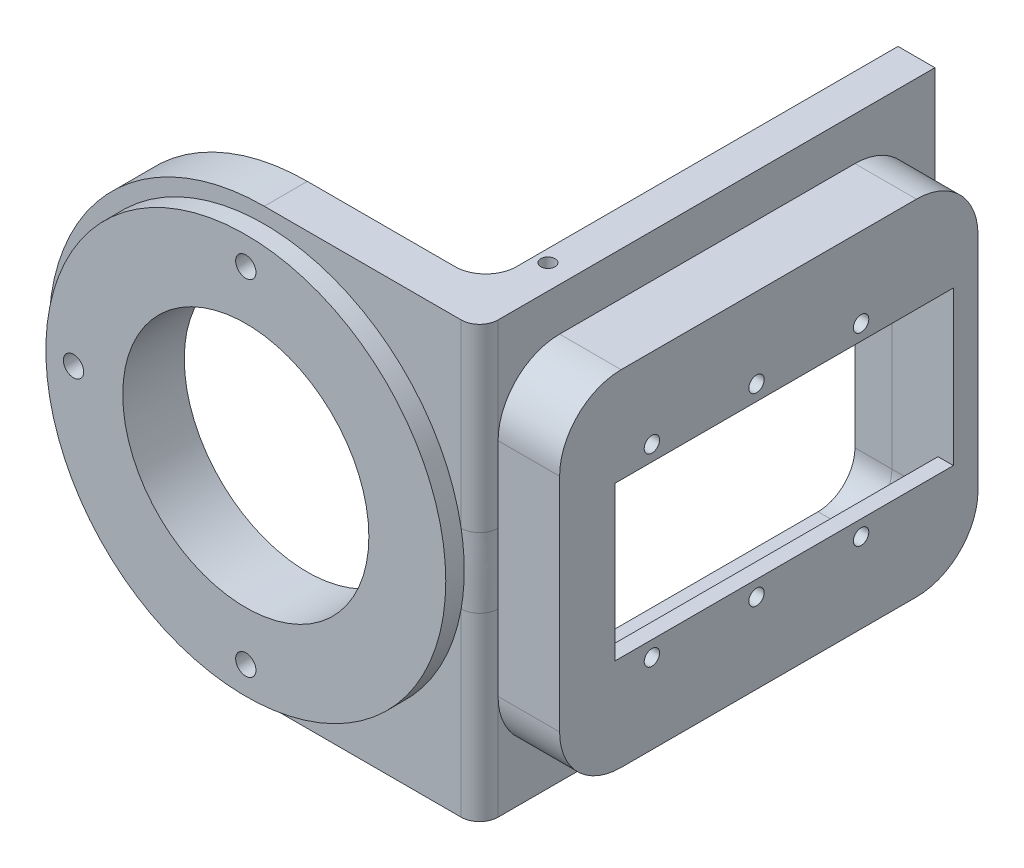
from build123d import *

# Parameters (mm, degrees)
SKETCH1_R           = 32.5
BOSS_EXTRUDE1_DEPTH = 3
SKETCH10_W          = 70
SKETCH10_H          = 70
BOSS_EXTRUDE6_DEPTH = 74
BOSS_EXTRUDE2_DEPTH = 10
SKETCH11_W          = 64
SKETCH11_H          = 67
CUT_EXTRUDE5_DEPTH  = 114.375482358
CUT_EXTRUDE2_DEPTH  = 110.79070999
SKETCH5_R           = 1.25
BOSS_EXTRUDE3_DEPTH = 2.5
CUT_EXTRUDE6_DEPTH  = 6
FILLET1_R           = 3
SKETCH17_R          = 1.65
CUT_EXTRUDE9_DEPTH  = 88.971586438
SKETCH19_W          = 2
SKETCH19_H          = 4.2
CUT_EXTRUDE10_DEPTH = 4
SKETCH21_W          = 2
SKETCH21_H          = 4.2
CUT_EXTRUDE11_DEPTH = 4
SKETCH22_R          = 1.15
CUT_EXTRUDE12_DEPTH = 4
SKETCH24_R          = 20
CUT_EXTRUDE14_DEPTH = 10
FILLET4_START       = -35
FILLET4_DEPTH       = 17.0000001
FILLET4_START_2     = 17.9999999
FILLET4_2_DEPTH     = 17.0000001
FILLET4_START_3     = 23.9999999
FILLET4_3_DEPTH     = 5.0000001
FILLET6_R           = 35
SKETCH25_W          = 4.2
SKETCH25_H          = 2
CUT_EXTRUDE15_DEPTH = 4
SKETCH26_R          = 1.15
CUT_EXTRUDE16_DEPTH = 10


with BuildPart() as part:
    # Sketch1 → Boss-Extrude1 (new body)
    with BuildSketch(Plane.XY):
        Circle(SKETCH1_R)
    extrude(amount=-BOSS_EXTRUDE1_DEPTH)

    # Sketch10 → Boss-Extrude6 (add)
    with BuildSketch(Plane(origin=(0, 0, -3), x_dir=(-1, 0, 0), z_dir=(0, 0, -1))):
        Rectangle(SKETCH10_W, SKETCH10_H)
    extrude(amount=BOSS_EXTRUDE6_DEPTH)

    # Sketch11 → Cut-Extrude5 (cut, through all)
    with BuildSketch(Plane(origin=(0, 35, 0), x_dir=(1, 0, 0), z_dir=(0, 1, 0))):
        with Locations((-3, 43.5)):
            Rectangle(SKETCH11_W, SKETCH11_H)
    extrude(amount=-CUT_EXTRUDE5_DEPTH, mode=Mode.SUBTRACT)

    # Sketch13 → Cut-Extrude6 (cut)
    with BuildSketch(Plane(origin=(35, 0, 0), x_dir=(0, 0, -1), z_dir=(1, 0, 0))):
        with BuildLine():
            Line((10, 18), (10, -18))
            ThreePointArc((10, -18), (11.757359313, -22.242640687), (16, -24))
            Line((16, -24), (64, -24))
            ThreePointArc((64, -24), (68.242640687, -22.242640687), (70, -18))
            Line((70, -18), (70, 18))
            ThreePointArc((70, 18), (68.242640687, 22.242640687), (64, 24))
            Line((64, 24), (16, 24))
            ThreePointArc((16, 24), (11.757359313, 22.242640687), (10, 18))
        make_face()
    extrude(amount=-CUT_EXTRUDE6_DEPTH, mode=Mode.SUBTRACT)

    # Fillet1
    fillet1_edges = [part.edges().sort_by_distance(p)[0] for p in [
        (35, 0, -3),
    ]]
    fillet(fillet1_edges, radius=FILLET1_R)

    # Sketch17 → Cut-Extrude9 (cut, through all)
    with BuildSketch(Plane(origin=(0, 0, -10), x_dir=(-1, 0, 0), z_dir=(0, 0, -1))):
        with Locations((0, 28)):
            Circle(SKETCH17_R)
        with Locations((28, 0)):
            Circle(SKETCH17_R)
        with Locations((0, -28)):
            Circle(SKETCH17_R)
    extrude(amount=-CUT_EXTRUDE9_DEPTH, mode=Mode.SUBTRACT)

    # Sketch19 → Cut-Extrude10 (cut)
    with BuildSketch(Plane.ZY.offset(-29)):
        with Locations((-72, 25.9)):
            Rectangle(SKETCH19_W, SKETCH19_H)
        with Locations((-72, -25.9)):
            Rectangle(SKETCH19_W, SKETCH19_H)
    extrude(amount=-CUT_EXTRUDE10_DEPTH, mode=Mode.SUBTRACT)

    # Sketch21 → Cut-Extrude11 (cut)
    with BuildSketch(Plane(origin=(0, 0, -10), x_dir=(-1, 0, 0), z_dir=(0, 0, -1))):
        with Locations((30, 25.9)):
            Rectangle(SKETCH21_W, SKETCH21_H)
        with Locations((30, -25.9)):
            Rectangle(SKETCH21_W, SKETCH21_H)
    extrude(amount=-CUT_EXTRUDE11_DEPTH, mode=Mode.SUBTRACT)

    # Sketch22 → Cut-Extrude12 (cut)
    with BuildSketch(Plane(origin=(0, 0, -77), x_dir=(-1, 0, 0), z_dir=(0, 0, -1))):
        with Locations((-31, 25.9)):
            Circle(SKETCH22_R)
        with Locations((-31, -25.9)):
            Circle(SKETCH22_R)
    extrude(amount=-CUT_EXTRUDE12_DEPTH, mode=Mode.SUBTRACT)

    # Sketch24 → Cut-Extrude14 (cut)
    with BuildSketch(Plane(origin=(0, 0, -10), x_dir=(-1, 0, 0), z_dir=(0, 0, -1))):
        Circle(SKETCH24_R)
    extrude(amount=-CUT_EXTRUDE14_DEPTH, mode=Mode.SUBTRACT)

    # Fillet4: read off the stored shape, not the designer's step
    # Fillet4 outline → Fillet4 (add)
    with BuildSketch(Plane(origin=(0, 0, 0), x_dir=(1, 0, 0), z_dir=(0, 1, 0)).offset(FILLET4_START)):
        with BuildLine():
            Line((29, 10), (29, 15))
            ThreePointArc((29, 15), (27.535533906, 11.464466094), (24, 10))
            Line((24, 10), (29, 10))
        make_face()
    extrude(amount=FILLET4_DEPTH)

    # Fillet4 2 outline → Fillet4 2 (add)
    with BuildSketch(Plane(origin=(0, 0, 0), x_dir=(1, 0, 0), z_dir=(0, 1, 0)).offset(FILLET4_START_2)):
        with BuildLine():
            Line((29, 10), (29, 15))
            ThreePointArc((29, 15), (27.535533906, 11.464466094), (24, 10))
            Line((24, 10), (29, 10))
        make_face()
    extrude(amount=FILLET4_2_DEPTH)

    # Fillet4 3 outline → Fillet4 3 (cut)
    with BuildSketch(Plane.YZ.offset(FILLET4_START_3)):
        with BuildLine():
            Line((17.9999999, -16), (24, -16))
            ThreePointArc((24, -16), (22.242640687, -11.757359313), (18, -10))
            Line((18, -10), (17.9999999, -16))
        make_face()
        with BuildLine():
            Line((-24, -16), (-17.9999999, -16))
            Line((-17.9999999, -16), (-18, -10))
            ThreePointArc((-18, -10), (-22.242640687, -11.757359313), (-24, -16))
        make_face()
    extrude(amount=FILLET4_3_DEPTH, mode=Mode.SUBTRACT)

    # Fillet6
    fillet6_edges = [part.edges().sort_by_distance(p)[0] for p in [
        (-35, -35, -6.5),
        (-35, 35, -6.5),
    ]]
    fillet(fillet6_edges, radius=FILLET6_R - 0.0001)  # a hair under: the kernel refuses the full size

    # Sketch25 → Cut-Extrude15 (cut)
    with BuildSketch(Plane(origin=(29, 0, 19), x_dir=(0, 0, 1), z_dir=(-1, 0, 0))):
        with Locations((-37.1, -30)):
            Rectangle(SKETCH25_W, SKETCH25_H)
    cut_extrude15 = extrude(amount=-CUT_EXTRUDE15_DEPTH, mode=Mode.SUBTRACT)

    # Sketch26 → Cut-Extrude16 (cut)
    with BuildSketch(Plane.XZ.offset(29)):
        with Locations(Location((31, -18.1, 0), (0, 0, 90))):
            Circle(SKETCH26_R)
    cut_extrude16 = extrude(amount=CUT_EXTRUDE16_DEPTH, mode=Mode.SUBTRACT)

    # Mirror1: Cut-Extrude15, Cut-Extrude16 across plane
    add(cut_extrude15.mirror(Plane(origin=(0, 0, 0), x_dir=(0, 0, 1), z_dir=(0, -1, 0))), mode=Mode.SUBTRACT)
    add(cut_extrude16.mirror(Plane(origin=(0, 0, 0), x_dir=(0, 0, 1), z_dir=(0, -1, 0))), mode=Mode.SUBTRACT)


with BuildPart() as body_2:
    # Sketch2 → Boss-Extrude2 (new body)
    with BuildSketch(Plane(origin=(45, 0, 0), x_dir=(0, 0, -1), z_dir=(1, 0, 0))):
        with BuildLine():
            Line((16, -28), (64, -28))
            ThreePointArc((64, -28), (71.071067812, -25.071067812), (74, -18))
            Line((74, -18), (74, 18))
            ThreePointArc((74, 18), (71.071067812, 25.071067812), (64, 28))
            Line((64, 28), (16, 28))
            ThreePointArc((16, 28), (8.928932188, 25.071067812), (6, 18))
            Line((6, 18), (6, -18))
            ThreePointArc((6, -18), (8.928932188, -25.071067812), (16, -28))
        make_face()
    extrude(amount=-BOSS_EXTRUDE2_DEPTH)

    # Sketch4 → Cut-Extrude2 (cut, through all)
    with BuildSketch(Plane.ZY.offset(-35)):
        with BuildLine():
            Line((-64, -24), (-16, -24))
            ThreePointArc((-16, -24), (-11.757359313, -22.242640687), (-10, -18))
            Line((-10, -18), (-10, 18))
            ThreePointArc((-10, 18), (-11.757359313, 22.242640687), (-16, 24))
            Line((-16, 24), (-64, 24))
            ThreePointArc((-64, 24), (-68.242640687, 22.242640687), (-70, 18))
            Line((-70, 18), (-70, -18))
            ThreePointArc((-70, -18), (-68.242640687, -22.242640687), (-64, -24))
        make_face()
    extrude(amount=-CUT_EXTRUDE2_DEPTH, mode=Mode.SUBTRACT)

    # Sketch5 → Boss-Extrude3 (add)
    with BuildSketch(Plane(origin=(45, 0, 0), x_dir=(0, 0, -1), z_dir=(1, 0, 0))):
        with BuildLine():
            Line((70, 18), (70, 12.5))
            Line((70, 12.5), (15, 12.5))
            Line((15, 12.5), (15, -12.5))
            Line((15, -12.5), (70, -12.5))
            Line((70, -12.5), (70, -18))
            ThreePointArc((70, -18), (68.242640687, -22.242640687), (64, -24))
            Line((64, -24), (16, -24))
            ThreePointArc((16, -24), (11.757359313, -22.242640687), (10, -18))
            Line((10, -18), (10, 18))
            ThreePointArc((10, 18), (11.757359313, 22.242640687), (16, 24))
            Line((16, 24), (64, 24))
            ThreePointArc((64, 24), (68.242640687, 22.242640687), (70, 18))
        make_face()
        with Locations(Location((55, 15, 0), (0, 0, 180))):
            Circle(SKETCH5_R, mode=Mode.SUBTRACT)
        with Locations((38, -15)):
            Circle(SKETCH5_R, mode=Mode.SUBTRACT)
        with Locations((21, -15)):
            Circle(SKETCH5_R, mode=Mode.SUBTRACT)
        with Locations(Location((38, 15, 0), (0, 0, 180))):
            Circle(SKETCH5_R, mode=Mode.SUBTRACT)
        with Locations(Location((21, 15, 0), (0, 0, 180))):
            Circle(SKETCH5_R, mode=Mode.SUBTRACT)
        with Locations((55, -15)):
            Circle(SKETCH5_R, mode=Mode.SUBTRACT)
    extrude(amount=-BOSS_EXTRUDE3_DEPTH)


solid = Compound([part.part, body_2.part])
